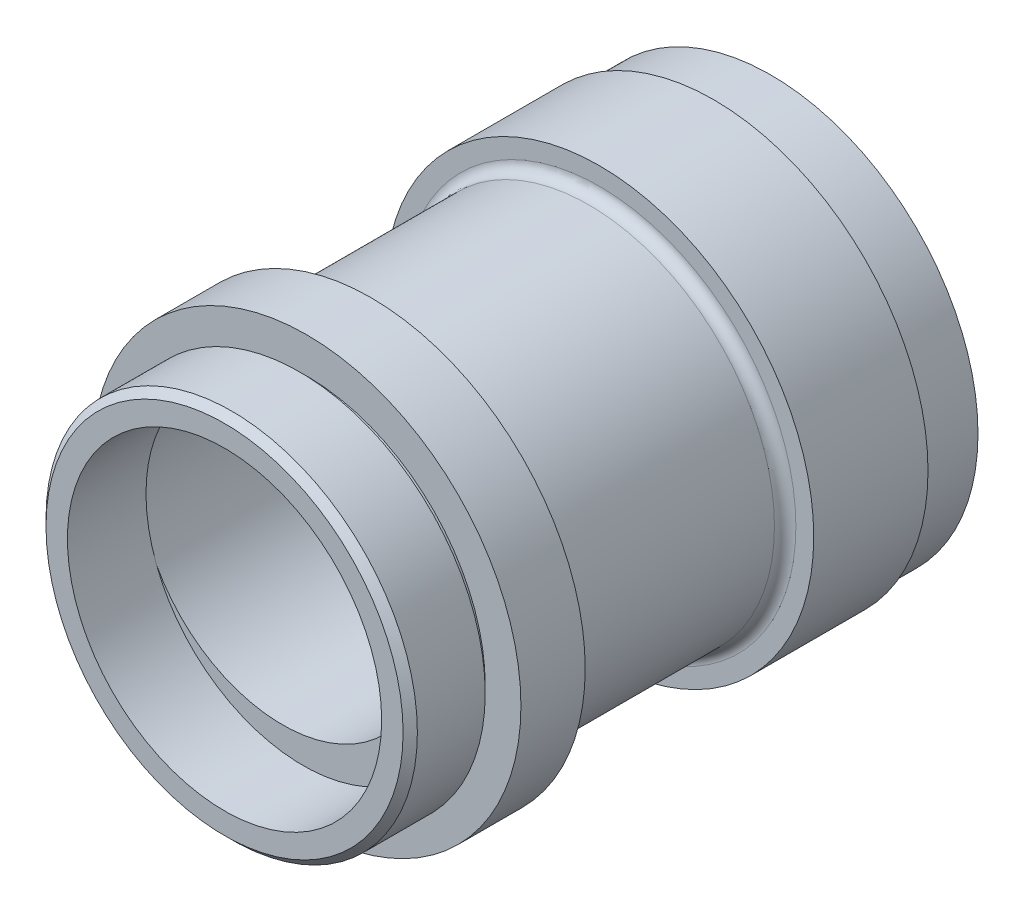
from build123d import *

# Parameters (mm, degrees)
SKETCH1_R                    = 14.5
BOSS_EXTRUDE1_DEPTH          = 4
SKETCH2_R                    = 15
BOSS_EXTRUDE2_DEPTH          = 8
SKETCH3_R                    = 13
BOSS_EXTRUDE3_DEPTH          = 16
SKETCH4_R                    = 15
BOSS_EXTRUDE4_DEPTH          = 4.5
SKETCH5_R                    = 12.5
BOSS_EXTRUDE5_DEPTH          = 0.5
SKETCH6_R                    = 13
BOSS_EXTRUDE6_DEPTH          = 5.25
SKETCH7_R                    = 11
CUT_EXTRUDE1_DEPTH           = 5.5
SKETCH8_R                    = 10
CUT_EXTRUDE2_DEPTH           = 32.75
FILLET1_R                    = 0.75
CHAMFER1_SIZE                = 0.5
F_2_0_2_DIAMETER_HOLE3_D     = 2
F_2_0_2_DIAMETER_HOLE3_DEPTH = 9.25
F_2_0_2_DIAMETER_HOLE3_TIP   = 0.600860619
CUT_EXTRUDE3_REACH           = 45.739
SKETCH17_R                   = 1
SKETCH18_R                   = 1
CUT_EXTRUDE4_DEPTH           = 13


with BuildPart() as part:
    # Sketch1 → Boss-Extrude1 (new body)
    with BuildSketch(Plane.XY):
        Circle(SKETCH1_R)
    extrude(amount=BOSS_EXTRUDE1_DEPTH)

    # Sketch2 → Boss-Extrude2 (add)
    with BuildSketch(Plane.XY.offset(4)):
        Circle(SKETCH2_R)
    extrude(amount=BOSS_EXTRUDE2_DEPTH)

    # Sketch3 → Boss-Extrude3 (add)
    with BuildSketch(Plane.XY.offset(12)):
        Circle(SKETCH3_R)
    extrude(amount=BOSS_EXTRUDE3_DEPTH)

    # Sketch4 → Boss-Extrude4 (add)
    with BuildSketch(Plane.XY.offset(28)):
        Circle(SKETCH4_R)
    extrude(amount=BOSS_EXTRUDE4_DEPTH)

    # Sketch5 → Boss-Extrude5 (add)
    with BuildSketch(Plane.XY.offset(32.5)):
        Circle(SKETCH5_R)
    extrude(amount=BOSS_EXTRUDE5_DEPTH)

    # Sketch6 → Boss-Extrude6 (add)
    with BuildSketch(Plane.XY.offset(33)):
        Circle(SKETCH6_R)
    extrude(amount=BOSS_EXTRUDE6_DEPTH)

    # Sketch7 → Cut-Extrude1 (cut)
    with BuildSketch(Plane.XY.offset(38.25)):
        Circle(SKETCH7_R)
    extrude(amount=-CUT_EXTRUDE1_DEPTH, mode=Mode.SUBTRACT)

    # Sketch8 → Cut-Extrude2 (cut)
    with BuildSketch(Plane.XY.offset(32.75)):
        with Locations((-1.44, 0.75)):
            Circle(SKETCH8_R)
    extrude(amount=-CUT_EXTRUDE2_DEPTH, mode=Mode.SUBTRACT)

    # Fillet1
    fillet1_edges = [part.edges().sort_by_distance(p)[0] for p in [
        (-13, 0, 12),
        (-13, 0, 28),
    ]]
    fillet(fillet1_edges, radius=FILLET1_R)

    # Chamfer1
    chamfer1_edges = [part.edges().sort_by_distance(p)[0] for p in [
        (-13, 0, 38.25),
    ]]
    chamfer(chamfer1_edges, length=CHAMFER1_SIZE)

    # Ø2.0 (2) Diameter Hole3
    with Locations(Plane(origin=(0, 0, 0), x_dir=(-1, 0, 0), z_dir=(0, 0, -1))):
        with Locations((-9.5, 8.9)):
            Hole(F_2_0_2_DIAMETER_HOLE3_D / 2, depth=F_2_0_2_DIAMETER_HOLE3_DEPTH)
            with Locations((0, 0, -(F_2_0_2_DIAMETER_HOLE3_DEPTH + F_2_0_2_DIAMETER_HOLE3_TIP / 2))):  # 118° drill point
                Cone(0, F_2_0_2_DIAMETER_HOLE3_D / 2, F_2_0_2_DIAMETER_HOLE3_TIP, mode=Mode.SUBTRACT)

    # Sketch17 → Cut-Extrude3 (cut, up to next)
    with BuildSketch(Plane(origin=(0, 0, 0), x_dir=(0, 0, -1), z_dir=(0.7297767184385453, 0.683685557274006, 0)), mode=Mode.PRIVATE) as cut_extrude3_sk1:
        with Locations((-20, 0)):
            Circle(SKETCH17_R)
    cut_extrude3_tool1 = extrude(cut_extrude3_sk1.sketch, amount=-CUT_EXTRUDE3_REACH, mode=Mode.PRIVATE) & part.part
    add(cut_extrude3_tool1.solids().sort_by_distance((0, 0, 20))[0], mode=Mode.SUBTRACT)

    # Sketch18 → Cut-Extrude4 (cut)
    with BuildSketch(Plane(origin=(0, 0, 0), x_dir=(0, 0, -1), z_dir=(0.7297767184385453, 0.683685557274006, 0))):
        with Locations((-9, 0)):
            Circle(SKETCH18_R)
    extrude(amount=CUT_EXTRUDE4_DEPTH, mode=Mode.SUBTRACT)


solid = part.part
